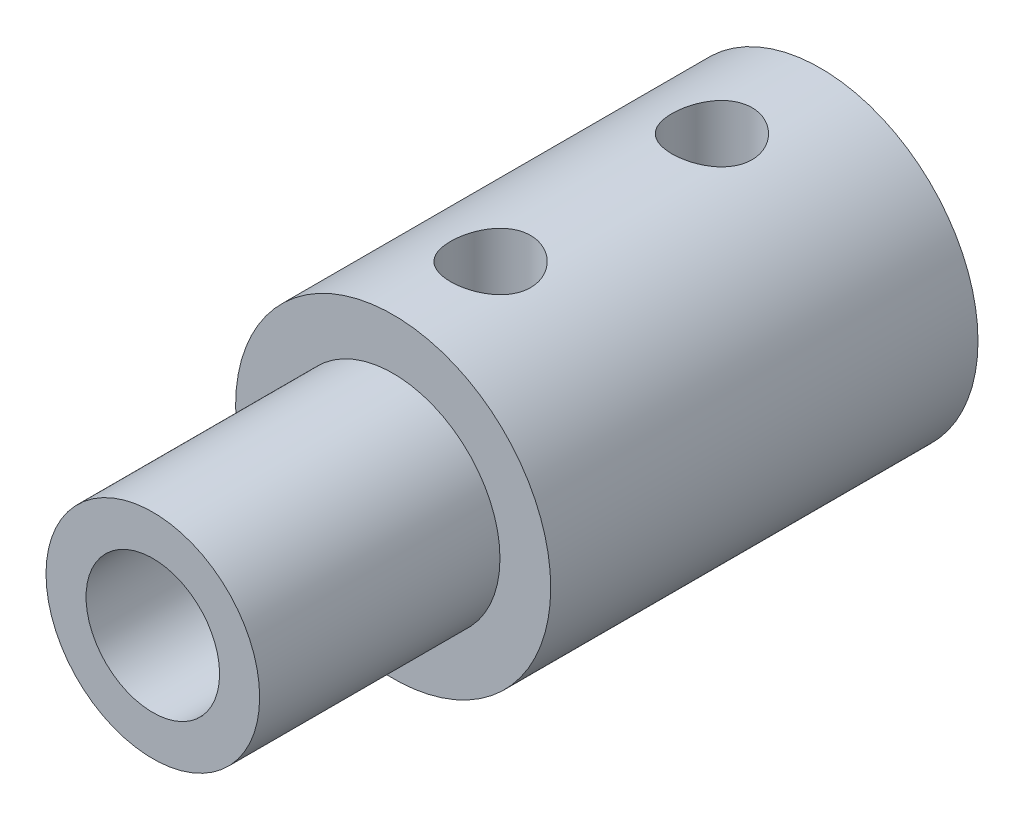
from build123d import *

# Parameters (mm, degrees)
SKETCH_1_R          = 5.9
EXTRUDE_1_DEPTH     = 25
SKETCH_2_R          = 2.5
CUT_EXTRUDE_2_DEPTH = 10
SKETCH_3_R          = 1.5
CUT_EXTRUDE_3_DEPTH = 15
SKETCH_5_R          = 1.5
CUT_EXTRUDE_4_DEPTH = 6
CUT_EXTRUDE_START   = -9
SKETCH_6_R          = 5.9
SKETCH_6_R_2        = 4
CUT_EXTRUDE_5_DEPTH = 9


with BuildPart() as part:
    # Эскиз1 → Вытянуть1 (new body)
    with BuildSketch(Plane.XY):
        Circle(SKETCH_1_R)
    extrude(amount=EXTRUDE_1_DEPTH)

    # Эскиз2 → Вытянуть2 (cut)
    with BuildSketch(Plane.XY.offset(25)):
        Circle(SKETCH_2_R)
    extrude(amount=-CUT_EXTRUDE_2_DEPTH, mode=Mode.SUBTRACT)

    # Эскиз3 → Вытянуть3 (cut)
    with BuildSketch(Plane(origin=(0, 0, 0), x_dir=(-1, 0, 0), z_dir=(0, 0, -1))):
        Circle(SKETCH_3_R)
    extrude(amount=-CUT_EXTRUDE_3_DEPTH, mode=Mode.SUBTRACT)

    # Эскиз5 → Вытянуть4 (cut)
    with BuildSketch(Plane(origin=(0, 7, 0), x_dir=(-1, 0, 0), z_dir=(0, 1, 0))):
        with Locations((0, 4.063182322)):
            Circle(SKETCH_5_R)
        with Locations((0, 12.352632006)):
            Circle(SKETCH_5_R)
    extrude(amount=-CUT_EXTRUDE_4_DEPTH, mode=Mode.SUBTRACT)

    # Эскиз6 → Вытянуть5 (cut)
    with BuildSketch(Plane.XY.offset(25).offset(CUT_EXTRUDE_START)):
        Circle(SKETCH_6_R)
        Circle(SKETCH_6_R_2, mode=Mode.SUBTRACT)
    extrude(amount=CUT_EXTRUDE_5_DEPTH, mode=Mode.SUBTRACT)


solid = part.part
